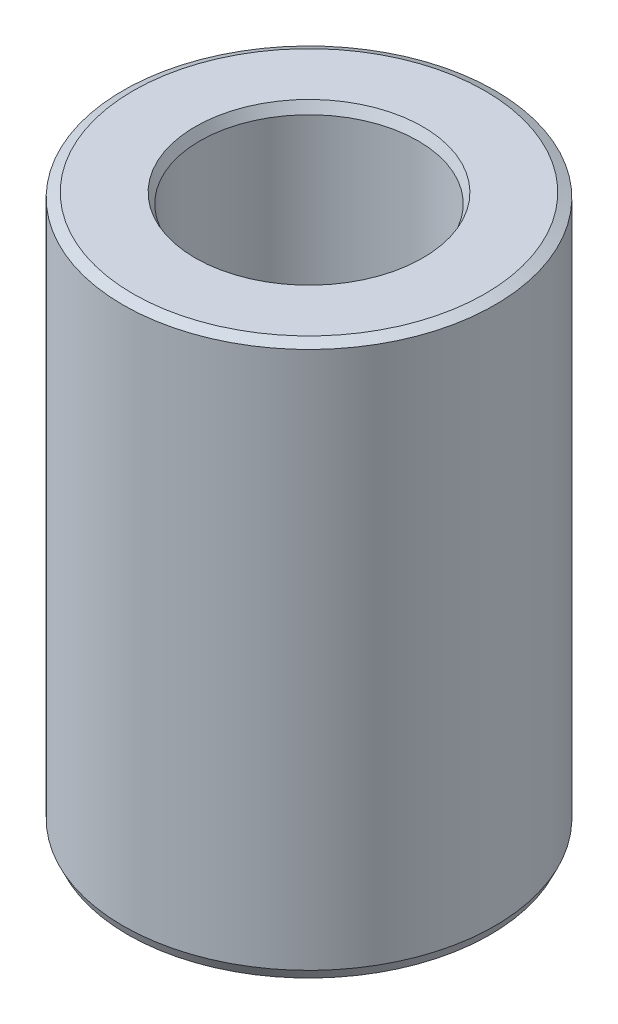
from build123d import *
from OCP.BRepFilletAPI import BRepFilletAPI_MakeChamfer

# Parameters (mm, degrees)
SKETCH1_R           = 47.5
BOSS_EXTRUDE1_DEPTH = 141.163090888
SKETCH2_R           = 27.881106142
CUT_EXTRUDE1_DEPTH  = 157.331437111
CHAMFER1_SIZE       = 1.198518148
CHAMFER1_SIZE2      = 2.543745316


with BuildPart() as part:
    # Sketch1 → Boss-Extrude1 (new body)
    with BuildSketch(Plane(origin=(0, 0, 0), x_dir=(1, 0, 0), z_dir=(0, 1, 0))):
        Circle(SKETCH1_R)
    extrude(amount=BOSS_EXTRUDE1_DEPTH)

    # Sketch2 → Cut-Extrude1 (cut, through all)
    with BuildSketch(Plane(origin=(0, 0, 0), x_dir=(1, 0, 0), z_dir=(0, 1, 0))):
        Circle(SKETCH2_R)
    extrude(amount=CUT_EXTRUDE1_DEPTH, mode=Mode.SUBTRACT)

    # Chamfer1: one chamfer whose edges measure the first distance from different faces: ONE call of the kernel's chamfer builder (chamfer() names one face for all edges)
    chamfer1_edges_1 = [part.edges().sort_by_distance(p)[0] for p in [
        (-27.881106142, 141.163090888, 0),
    ]]
    chamfer1_side_1 = [part.faces().sort_by_distance(p)[0] for p in [
        (-46.156497116, 141.163090888, 0),
    ]]
    chamfer1_edges_2 = [part.edges().sort_by_distance(p)[0] for p in [
        (-27.881106142, 0, 0),
    ]]
    chamfer1_side_2 = [part.faces().sort_by_distance(p)[0] for p in [
        (-27.881106142, 70.581545444, 0),
    ]]
    chamfer1_edges_3 = [part.edges().sort_by_distance(p)[0] for p in [
        (-47.5, 0, 0),
    ]]
    chamfer1_side_3 = [part.faces().sort_by_distance(p)[0] for p in [
        (-46.156497116, 0, 0),
    ]]
    chamfer1_edges_4 = [part.edges().sort_by_distance(p)[0] for p in [
        (-47.5, 141.163090888, 0),
    ]]
    chamfer1_side_4 = [part.faces().sort_by_distance(p)[0] for p in [
        (-47.5, 70.581545444, 0),
    ]]
    chamfer1 = BRepFilletAPI_MakeChamfer(part.part.solid().wrapped)
    for e in chamfer1_edges_1:
        chamfer1.Add(CHAMFER1_SIZE, CHAMFER1_SIZE2, e.wrapped, chamfer1_side_1[0].wrapped)  # the first distance lies on this face
    for e in chamfer1_edges_2:
        chamfer1.Add(CHAMFER1_SIZE, CHAMFER1_SIZE2, e.wrapped, chamfer1_side_2[0].wrapped)  # the first distance lies on this face
    for e in chamfer1_edges_3:
        chamfer1.Add(CHAMFER1_SIZE, CHAMFER1_SIZE2, e.wrapped, chamfer1_side_3[0].wrapped)  # the first distance lies on this face
    for e in chamfer1_edges_4:
        chamfer1.Add(CHAMFER1_SIZE, CHAMFER1_SIZE2, e.wrapped, chamfer1_side_4[0].wrapped)  # the first distance lies on this face
    add(Compound.cast(chamfer1.Shape()), mode=Mode.REPLACE)


solid = part.part
